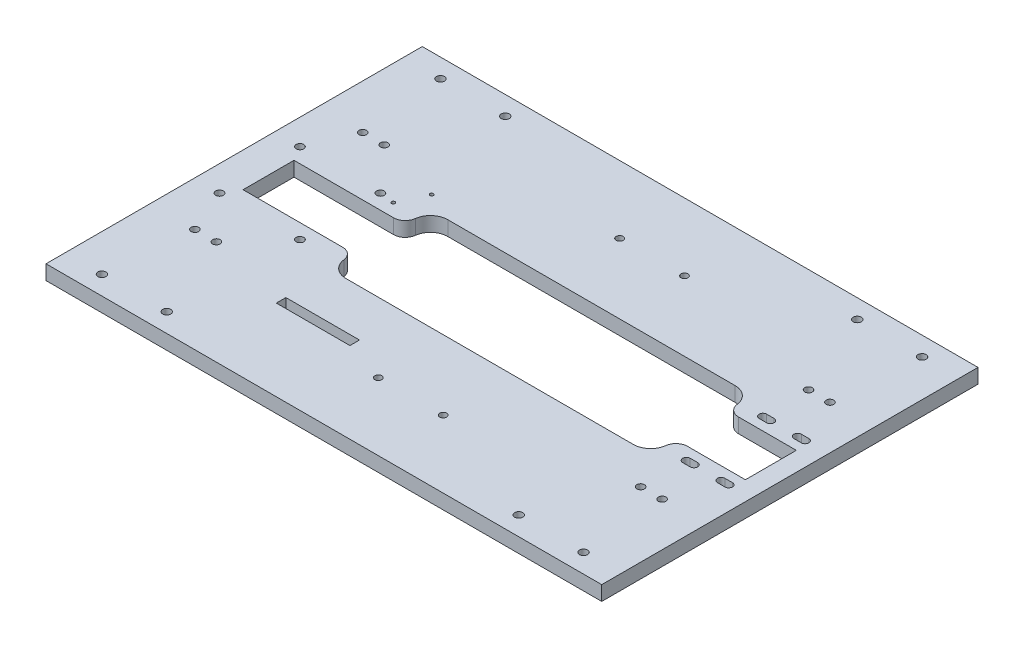
from build123d import *

# Parameters (mm, degrees)
SKETCH1_W           = 480
SKETCH1_H           = 325
BOSS_EXTRUDE1_DEPTH = 12.6
CUT_EXTRUDE1_REACH  = 292.112
SKETCH2_R           = 3
CUT_EXTRUDE2_REACH  = 292.112
FILLET1_R           = 10
CUT_EXTRUDE3_REACH  = 292.112
SKETCH4_R           = 3.3
FILLET2_R           = 10
CUT_EXTRUDE7_REACH  = 292.112
SKETCH7_R           = 2.25
SKETCH8_R           = 3.5
CUT_EXTRUDE8_DEPTH  = 6
CUT_EXTRUDE11_REACH = 292.112
SKETCH12_R          = 1.5
FILLET3_R           = 15
SKETCH14_W          = 63.584161833
SKETCH14_H          = 8.257095536
CUT_EXTRUDE13_DEPTH = 291.112064697
CUT_EXTRUDE14_REACH = 292.112
SKETCH15_R          = 3.25
CUT_EXTRUDE15_REACH = 292.112


with BuildPart() as part:
    # Sketch1 → Boss-Extrude1 (new body)
    with BuildSketch(Plane(origin=(0, 0, 0), x_dir=(1, 0, 0), z_dir=(0, 1, 0))):
        Rectangle(SKETCH1_W, SKETCH1_H)
    extrude(amount=BOSS_EXTRUDE1_DEPTH)

    # Sketch2 → Cut-Extrude1 (cut, up to next)
    with BuildSketch(Plane.XZ, mode=Mode.PRIVATE) as cut_extrude1_sk1:
        with Locations((44.748582867, -104.2)):
            Circle(SKETCH2_R)
    cut_extrude1_tool1 = extrude(cut_extrude1_sk1.sketch, amount=-CUT_EXTRUDE1_REACH, mode=Mode.PRIVATE) & part.part
    # Sketch2 → Cut-Extrude1 (cut, up to next)
    with BuildSketch(Plane.XZ, mode=Mode.PRIVATE) as cut_extrude1_sk2:
        with Locations((-11.251417133, -104.2)):
            Circle(SKETCH2_R)
    cut_extrude1_tool2 = extrude(cut_extrude1_sk2.sketch, amount=-CUT_EXTRUDE1_REACH, mode=Mode.PRIVATE) & part.part
    # Sketch2 → Cut-Extrude1 (cut, up to next)
    with BuildSketch(Plane.XZ, mode=Mode.PRIVATE) as cut_extrude1_sk3:
        with Locations((44.748582867, 104.2)):
            Circle(SKETCH2_R)
    cut_extrude1_tool3 = extrude(cut_extrude1_sk3.sketch, amount=-CUT_EXTRUDE1_REACH, mode=Mode.PRIVATE) & part.part
    # Sketch2 → Cut-Extrude1 (cut, up to next)
    with BuildSketch(Plane.XZ, mode=Mode.PRIVATE) as cut_extrude1_sk4:
        with Locations((-11.251417133, 104.2)):
            Circle(SKETCH2_R)
    cut_extrude1_tool4 = extrude(cut_extrude1_sk4.sketch, amount=-CUT_EXTRUDE1_REACH, mode=Mode.PRIVATE) & part.part
    add(cut_extrude1_tool1.solids().sort_by_distance((44.748583, 0, -104.2))[0], mode=Mode.SUBTRACT)
    add(cut_extrude1_tool2.solids().sort_by_distance((-11.251417, 0, -104.2))[0], mode=Mode.SUBTRACT)
    add(cut_extrude1_tool3.solids().sort_by_distance((44.748583, 0, 104.2))[0], mode=Mode.SUBTRACT)
    add(cut_extrude1_tool4.solids().sort_by_distance((-11.251417, 0, 104.2))[0], mode=Mode.SUBTRACT)

    # Sketch3 → Cut-Extrude2 (cut, up to next)
    with BuildSketch(Plane.XZ, mode=Mode.PRIVATE) as cut_extrude2_sk1:
        Polygon((163.584746975, 44), (-114.288669968, 44), (-114.288669968, 22), (-210.288669968, 22), (-210.288669968, -22), (-114.288669968, -22), (-114.288669968, -44), (163.584746975, -44), (163.584746975, -22), (223.584746975, -22), (223.584746975, 22), (163.584746975, 22), align=None)
    cut_extrude2_tool1 = extrude(cut_extrude2_sk1.sketch, amount=-CUT_EXTRUDE2_REACH, mode=Mode.PRIVATE) & part.part
    add(cut_extrude2_tool1.solids().sort_by_distance((13.675427, 0, 0))[0], mode=Mode.SUBTRACT)

    # Fillet1
    fillet1_edges = [part.edges().sort_by_distance(p)[0] for p in [
        (-114.288669968, 6.3, 22),
        (-114.288669968, 6.3, -22),
    ]]
    fillet(fillet1_edges, radius=FILLET1_R)

    # Sketch4 → Cut-Extrude3 (cut, up to next)
    with BuildSketch(Plane.XZ, mode=Mode.PRIVATE) as cut_extrude3_sk1:
        with Locations((-148.425714853, -34.75)):
            Circle(SKETCH4_R)
    cut_extrude3_tool1 = extrude(cut_extrude3_sk1.sketch, amount=-CUT_EXTRUDE3_REACH, mode=Mode.PRIVATE) & part.part
    # Sketch4 → Cut-Extrude3 (cut, up to next)
    with BuildSketch(Plane.XZ, mode=Mode.PRIVATE) as cut_extrude3_sk2:
        with Locations((-148.425714853, 34.75)):
            Circle(SKETCH4_R)
    cut_extrude3_tool2 = extrude(cut_extrude3_sk2.sketch, amount=-CUT_EXTRUDE3_REACH, mode=Mode.PRIVATE) & part.part
    # Sketch4 → Cut-Extrude3 (cut, up to next)
    with BuildSketch(Plane.XZ, mode=Mode.PRIVATE) as cut_extrude3_sk3:
        with Locations((-217.925714853, 34.75)):
            Circle(SKETCH4_R)
    cut_extrude3_tool3 = extrude(cut_extrude3_sk3.sketch, amount=-CUT_EXTRUDE3_REACH, mode=Mode.PRIVATE) & part.part
    # Sketch4 → Cut-Extrude3 (cut, up to next)
    with BuildSketch(Plane.XZ, mode=Mode.PRIVATE) as cut_extrude3_sk4:
        with Locations((-217.925714853, -34.75)):
            Circle(SKETCH4_R)
    cut_extrude3_tool4 = extrude(cut_extrude3_sk4.sketch, amount=-CUT_EXTRUDE3_REACH, mode=Mode.PRIVATE) & part.part
    add(cut_extrude3_tool1.solids().sort_by_distance((-148.425715, 0, -34.75))[0], mode=Mode.SUBTRACT)
    add(cut_extrude3_tool2.solids().sort_by_distance((-148.425715, 0, 34.75))[0], mode=Mode.SUBTRACT)
    add(cut_extrude3_tool3.solids().sort_by_distance((-217.925715, 0, 34.75))[0], mode=Mode.SUBTRACT)
    add(cut_extrude3_tool4.solids().sort_by_distance((-217.925715, 0, -34.75))[0], mode=Mode.SUBTRACT)

    # Fillet2
    fillet2_edges = [part.edges().sort_by_distance(p)[0] for p in [
        (163.584746975, 6.3, -22),
        (163.584746975, 6.3, 22),
    ]]
    fillet(fillet2_edges, radius=FILLET2_R)

    # Sketch7 → Cut-Extrude7 (cut, up to next)
    with BuildSketch(Plane(origin=(0, 12.6, 0), x_dir=(1, 0, 0), z_dir=(0, 1, 0)), mode=Mode.PRIVATE) as cut_extrude7_sk1:
        with Locations((208, -146.2)):
            Circle(SKETCH7_R)
    cut_extrude7_tool1 = extrude(cut_extrude7_sk1.sketch, amount=-CUT_EXTRUDE7_REACH, mode=Mode.PRIVATE) & part.part
    # Sketch7 → Cut-Extrude7 (cut, up to next)
    with BuildSketch(Plane(origin=(0, 12.6, 0), x_dir=(1, 0, 0), z_dir=(0, 1, 0)), mode=Mode.PRIVATE) as cut_extrude7_sk2:
        with Locations((152, -146.2)):
            Circle(SKETCH7_R)
    cut_extrude7_tool2 = extrude(cut_extrude7_sk2.sketch, amount=-CUT_EXTRUDE7_REACH, mode=Mode.PRIVATE) & part.part
    # Sketch7 → Cut-Extrude7 (cut, up to next)
    with BuildSketch(Plane(origin=(0, 12.6, 0), x_dir=(1, 0, 0), z_dir=(0, 1, 0)), mode=Mode.PRIVATE) as cut_extrude7_sk3:
        with Locations((-152, -146.2)):
            Circle(SKETCH7_R)
    cut_extrude7_tool3 = extrude(cut_extrude7_sk3.sketch, amount=-CUT_EXTRUDE7_REACH, mode=Mode.PRIVATE) & part.part
    # Sketch7 → Cut-Extrude7 (cut, up to next)
    with BuildSketch(Plane(origin=(0, 12.6, 0), x_dir=(1, 0, 0), z_dir=(0, 1, 0)), mode=Mode.PRIVATE) as cut_extrude7_sk4:
        with Locations((-208, -146.2)):
            Circle(SKETCH7_R)
    cut_extrude7_tool4 = extrude(cut_extrude7_sk4.sketch, amount=-CUT_EXTRUDE7_REACH, mode=Mode.PRIVATE) & part.part
    # Sketch7 → Cut-Extrude7 (cut, up to next)
    with BuildSketch(Plane(origin=(0, 12.6, 0), x_dir=(1, 0, 0), z_dir=(0, 1, 0)), mode=Mode.PRIVATE) as cut_extrude7_sk5:
        with Locations((-208, 146.2)):
            Circle(SKETCH7_R)
    cut_extrude7_tool5 = extrude(cut_extrude7_sk5.sketch, amount=-CUT_EXTRUDE7_REACH, mode=Mode.PRIVATE) & part.part
    # Sketch7 → Cut-Extrude7 (cut, up to next)
    with BuildSketch(Plane(origin=(0, 12.6, 0), x_dir=(1, 0, 0), z_dir=(0, 1, 0)), mode=Mode.PRIVATE) as cut_extrude7_sk6:
        with Locations((-152, 146.2)):
            Circle(SKETCH7_R)
    cut_extrude7_tool6 = extrude(cut_extrude7_sk6.sketch, amount=-CUT_EXTRUDE7_REACH, mode=Mode.PRIVATE) & part.part
    # Sketch7 → Cut-Extrude7 (cut, up to next)
    with BuildSketch(Plane(origin=(0, 12.6, 0), x_dir=(1, 0, 0), z_dir=(0, 1, 0)), mode=Mode.PRIVATE) as cut_extrude7_sk7:
        with Locations((208, 146.2)):
            Circle(SKETCH7_R)
    cut_extrude7_tool7 = extrude(cut_extrude7_sk7.sketch, amount=-CUT_EXTRUDE7_REACH, mode=Mode.PRIVATE) & part.part
    # Sketch7 → Cut-Extrude7 (cut, up to next)
    with BuildSketch(Plane(origin=(0, 12.6, 0), x_dir=(1, 0, 0), z_dir=(0, 1, 0)), mode=Mode.PRIVATE) as cut_extrude7_sk8:
        with Locations((152, 146.2)):
            Circle(SKETCH7_R)
    cut_extrude7_tool8 = extrude(cut_extrude7_sk8.sketch, amount=-CUT_EXTRUDE7_REACH, mode=Mode.PRIVATE) & part.part
    add(cut_extrude7_tool1.solids().sort_by_distance((208, 12.6, 146.2))[0], mode=Mode.SUBTRACT)
    add(cut_extrude7_tool2.solids().sort_by_distance((152, 12.6, 146.2))[0], mode=Mode.SUBTRACT)
    add(cut_extrude7_tool3.solids().sort_by_distance((-152, 12.6, 146.2))[0], mode=Mode.SUBTRACT)
    add(cut_extrude7_tool4.solids().sort_by_distance((-208, 12.6, 146.2))[0], mode=Mode.SUBTRACT)
    add(cut_extrude7_tool5.solids().sort_by_distance((-208, 12.6, -146.2))[0], mode=Mode.SUBTRACT)
    add(cut_extrude7_tool6.solids().sort_by_distance((-152, 12.6, -146.2))[0], mode=Mode.SUBTRACT)
    add(cut_extrude7_tool7.solids().sort_by_distance((208, 12.6, -146.2))[0], mode=Mode.SUBTRACT)
    add(cut_extrude7_tool8.solids().sort_by_distance((152, 12.6, -146.2))[0], mode=Mode.SUBTRACT)

    # Sketch8 → Cut-Extrude8 (cut)
    with BuildSketch(Plane(origin=(0, 12.6, 0), x_dir=(1, 0, 0), z_dir=(0, 1, 0))):
        with Locations((208, 146.2)):
            Circle(SKETCH8_R)
        with Locations((152, 146.2)):
            Circle(SKETCH8_R)
        with Locations((-152, 146.2)):
            Circle(SKETCH8_R)
        with Locations((-208, 146.2)):
            Circle(SKETCH8_R)
        with Locations((208, -146.2)):
            Circle(SKETCH8_R)
        with Locations((152, -146.2)):
            Circle(SKETCH8_R)
        with Locations((-208, -146.2)):
            Circle(SKETCH8_R)
        with Locations((-152, -146.2)):
            Circle(SKETCH8_R)
    extrude(amount=-CUT_EXTRUDE8_DEPTH, mode=Mode.SUBTRACT)

    # Sketch12 → Cut-Extrude11 (cut, up to next)
    with BuildSketch(Plane.XZ, mode=Mode.PRIVATE) as cut_extrude11_sk1:
        with Locations((-135.814791711, -33.263055365)):
            Circle(SKETCH12_R)
    cut_extrude11_tool1 = extrude(cut_extrude11_sk1.sketch, amount=-CUT_EXTRUDE11_REACH, mode=Mode.PRIVATE) & part.part
    # Sketch12 → Cut-Extrude11 (cut, up to next)
    with BuildSketch(Plane.XZ, mode=Mode.PRIVATE) as cut_extrude11_sk2:
        with Locations((-125.214791711, -55.863055365)):
            Circle(SKETCH12_R)
    cut_extrude11_tool2 = extrude(cut_extrude11_sk2.sketch, amount=-CUT_EXTRUDE11_REACH, mode=Mode.PRIVATE) & part.part
    add(cut_extrude11_tool1.solids().sort_by_distance((-135.814792, 0, -33.263055))[0], mode=Mode.SUBTRACT)
    add(cut_extrude11_tool2.solids().sort_by_distance((-125.214792, 0, -55.863055))[0], mode=Mode.SUBTRACT)

    # Fillet3
    fillet3_edges = [part.edges().sort_by_distance(p)[0] for p in [
        (163.584746975, 6.3, 44),
        (163.584746975, 6.3, -44),
        (-114.288669968, 6.3, 44),
        (-114.288669968, 6.3, -44),
    ]]
    fillet(fillet3_edges, radius=FILLET3_R)

    # Sketch14 → Cut-Extrude13 (cut, through all)
    with BuildSketch(Plane(origin=(0, 12.6, 0), x_dir=(1, 0, 0), z_dir=(0, 1, 0))):
        with Locations((-79.365102285, -88.291865052)):
            Rectangle(SKETCH14_W, SKETCH14_H)
    extrude(amount=-CUT_EXTRUDE13_DEPTH, mode=Mode.SUBTRACT)

    # Sketch15 → Cut-Extrude14 (cut, up to next)
    with BuildSketch(Plane(origin=(0, 12.6, 0), x_dir=(1, 0, 0), z_dir=(0, 1, 0)), mode=Mode.PRIVATE) as cut_extrude14_sk1:
        with Locations((-201.37519906, -72.5)):
            Circle(SKETCH15_R)
    cut_extrude14_tool1 = extrude(cut_extrude14_sk1.sketch, amount=-CUT_EXTRUDE14_REACH, mode=Mode.PRIVATE) & part.part
    # Sketch15 → Cut-Extrude14 (cut, up to next)
    with BuildSketch(Plane(origin=(0, 12.6, 0), x_dir=(1, 0, 0), z_dir=(0, 1, 0)), mode=Mode.PRIVATE) as cut_extrude14_sk2:
        with Locations((-182.864719491, -72.5)):
            Circle(SKETCH15_R)
    cut_extrude14_tool2 = extrude(cut_extrude14_sk2.sketch, amount=-CUT_EXTRUDE14_REACH, mode=Mode.PRIVATE) & part.part
    # Sketch15 → Cut-Extrude14 (cut, up to next)
    with BuildSketch(Plane(origin=(0, 12.6, 0), x_dir=(1, 0, 0), z_dir=(0, 1, 0)), mode=Mode.PRIVATE) as cut_extrude14_sk3:
        with Locations((-201.37519906, 72.5)):
            Circle(SKETCH15_R)
    cut_extrude14_tool3 = extrude(cut_extrude14_sk3.sketch, amount=-CUT_EXTRUDE14_REACH, mode=Mode.PRIVATE) & part.part
    # Sketch15 → Cut-Extrude14 (cut, up to next)
    with BuildSketch(Plane(origin=(0, 12.6, 0), x_dir=(1, 0, 0), z_dir=(0, 1, 0)), mode=Mode.PRIVATE) as cut_extrude14_sk4:
        with Locations((-182.864719491, 72.5)):
            Circle(SKETCH15_R)
    cut_extrude14_tool4 = extrude(cut_extrude14_sk4.sketch, amount=-CUT_EXTRUDE14_REACH, mode=Mode.PRIVATE) & part.part
    # Sketch15 → Cut-Extrude14 (cut, up to next)
    with BuildSketch(Plane(origin=(0, 12.6, 0), x_dir=(1, 0, 0), z_dir=(0, 1, 0)), mode=Mode.PRIVATE) as cut_extrude14_sk5:
        with Locations((183.62480094, 72.5)):
            Circle(SKETCH15_R)
    cut_extrude14_tool5 = extrude(cut_extrude14_sk5.sketch, amount=-CUT_EXTRUDE14_REACH, mode=Mode.PRIVATE) & part.part
    # Sketch15 → Cut-Extrude14 (cut, up to next)
    with BuildSketch(Plane(origin=(0, 12.6, 0), x_dir=(1, 0, 0), z_dir=(0, 1, 0)), mode=Mode.PRIVATE) as cut_extrude14_sk6:
        with Locations((202.135280509, 72.5)):
            Circle(SKETCH15_R)
    cut_extrude14_tool6 = extrude(cut_extrude14_sk6.sketch, amount=-CUT_EXTRUDE14_REACH, mode=Mode.PRIVATE) & part.part
    # Sketch15 → Cut-Extrude14 (cut, up to next)
    with BuildSketch(Plane(origin=(0, 12.6, 0), x_dir=(1, 0, 0), z_dir=(0, 1, 0)), mode=Mode.PRIVATE) as cut_extrude14_sk7:
        with Locations((183.62480094, -72.5)):
            Circle(SKETCH15_R)
    cut_extrude14_tool7 = extrude(cut_extrude14_sk7.sketch, amount=-CUT_EXTRUDE14_REACH, mode=Mode.PRIVATE) & part.part
    # Sketch15 → Cut-Extrude14 (cut, up to next)
    with BuildSketch(Plane(origin=(0, 12.6, 0), x_dir=(1, 0, 0), z_dir=(0, 1, 0)), mode=Mode.PRIVATE) as cut_extrude14_sk8:
        with Locations((202.135280509, -72.5)):
            Circle(SKETCH15_R)
    cut_extrude14_tool8 = extrude(cut_extrude14_sk8.sketch, amount=-CUT_EXTRUDE14_REACH, mode=Mode.PRIVATE) & part.part
    add(cut_extrude14_tool1.solids().sort_by_distance((-201.375199, 12.6, 72.5))[0], mode=Mode.SUBTRACT)
    add(cut_extrude14_tool2.solids().sort_by_distance((-182.864719, 12.6, 72.5))[0], mode=Mode.SUBTRACT)
    add(cut_extrude14_tool3.solids().sort_by_distance((-201.375199, 12.6, -72.5))[0], mode=Mode.SUBTRACT)
    add(cut_extrude14_tool4.solids().sort_by_distance((-182.864719, 12.6, -72.5))[0], mode=Mode.SUBTRACT)
    add(cut_extrude14_tool5.solids().sort_by_distance((183.624801, 12.6, -72.5))[0], mode=Mode.SUBTRACT)
    add(cut_extrude14_tool6.solids().sort_by_distance((202.135281, 12.6, -72.5))[0], mode=Mode.SUBTRACT)
    add(cut_extrude14_tool7.solids().sort_by_distance((183.624801, 12.6, 72.5))[0], mode=Mode.SUBTRACT)
    add(cut_extrude14_tool8.solids().sort_by_distance((202.135281, 12.6, 72.5))[0], mode=Mode.SUBTRACT)

    # Sketch16 → Cut-Extrude15 (cut, up to next)
    with BuildSketch(Plane(origin=(0, 12.6, 0), x_dir=(1, 0, 0), z_dir=(0, 1, 0)), mode=Mode.PRIVATE) as cut_extrude15_sk1:
        with BuildLine():
            Line((183.672880587, -36.25), (190.172880587, -36.25))
            ThreePointArc((190.172880587, -36.25), (193.422880587, -33), (190.172880587, -29.75))
            Line((190.172880587, -29.75), (183.672880587, -29.75))
            ThreePointArc((183.672880587, -29.75), (180.422880587, -33), (183.672880587, -36.25))
        make_face()
    cut_extrude15_tool1 = extrude(cut_extrude15_sk1.sketch, amount=-CUT_EXTRUDE15_REACH, mode=Mode.PRIVATE) & part.part
    # Sketch16 → Cut-Extrude15 (cut, up to next)
    with BuildSketch(Plane(origin=(0, 12.6, 0), x_dir=(1, 0, 0), z_dir=(0, 1, 0)), mode=Mode.PRIVATE) as cut_extrude15_sk2:
        with BuildLine():
            Line((213.672880587, -36.25), (220.172880587, -36.25))
            ThreePointArc((220.172880587, -36.25), (223.422880587, -33), (220.172880587, -29.75))
            Line((220.172880587, -29.75), (213.672880587, -29.75))
            ThreePointArc((213.672880587, -29.75), (210.422880587, -33), (213.672880587, -36.25))
        make_face()
    cut_extrude15_tool2 = extrude(cut_extrude15_sk2.sketch, amount=-CUT_EXTRUDE15_REACH, mode=Mode.PRIVATE) & part.part
    # Sketch16 → Cut-Extrude15 (cut, up to next)
    with BuildSketch(Plane(origin=(0, 12.6, 0), x_dir=(1, 0, 0), z_dir=(0, 1, 0)), mode=Mode.PRIVATE) as cut_extrude15_sk3:
        with BuildLine():
            Line((183.672880587, 29.75), (190.172880587, 29.75))
            ThreePointArc((190.172880587, 29.75), (193.422880587, 33), (190.172880587, 36.25))
            Line((190.172880587, 36.25), (183.672880587, 36.25))
            ThreePointArc((183.672880587, 36.25), (180.422880587, 33), (183.672880587, 29.75))
        make_face()
    cut_extrude15_tool3 = extrude(cut_extrude15_sk3.sketch, amount=-CUT_EXTRUDE15_REACH, mode=Mode.PRIVATE) & part.part
    # Sketch16 → Cut-Extrude15 (cut, up to next)
    with BuildSketch(Plane(origin=(0, 12.6, 0), x_dir=(1, 0, 0), z_dir=(0, 1, 0)), mode=Mode.PRIVATE) as cut_extrude15_sk4:
        with BuildLine():
            Line((213.672880587, 29.75), (220.172880587, 29.75))
            ThreePointArc((220.172880587, 29.75), (223.422880587, 33), (220.172880587, 36.25))
            Line((220.172880587, 36.25), (213.672880587, 36.25))
            ThreePointArc((213.672880587, 36.25), (210.422880587, 33), (213.672880587, 29.75))
        make_face()
    cut_extrude15_tool4 = extrude(cut_extrude15_sk4.sketch, amount=-CUT_EXTRUDE15_REACH, mode=Mode.PRIVATE) & part.part
    add(cut_extrude15_tool1.solids().sort_by_distance((186.922881, 12.6, 33))[0], mode=Mode.SUBTRACT)
    add(cut_extrude15_tool2.solids().sort_by_distance((216.922881, 12.6, 33))[0], mode=Mode.SUBTRACT)
    add(cut_extrude15_tool3.solids().sort_by_distance((186.922881, 12.6, -33))[0], mode=Mode.SUBTRACT)
    add(cut_extrude15_tool4.solids().sort_by_distance((216.922881, 12.6, -33))[0], mode=Mode.SUBTRACT)


solid = part.part
